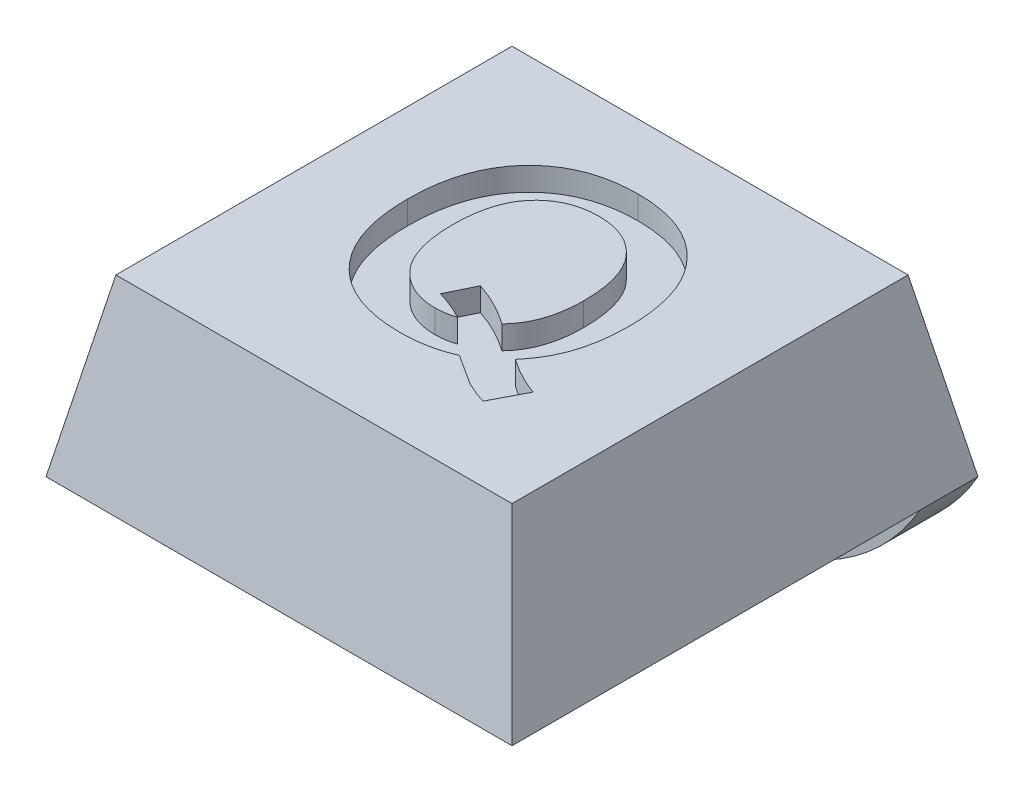
from build123d import *

# Parameters (mm, degrees)
SKETCH1_W               = 8
SKETCH1_H               = 8
BOSS_EXTRUDE1_DEPTH     = 3
CUT_EXTRUDE1_DEPTH      = 12.704699911
CUT_EXTRUDE1_DEPTH_BACK = 12.704699911
CUT_EXTRUDE2_DEPTH      = 11
SKETCH4_R               = 1.8
CUT_EXTRUDE3_DEPTH      = 0.8
SKETCH5_W               = 8
SKETCH5_H               = 1
BOSS_EXTRUDE2_DEPTH     = 2
FILLET1_R               = 4
CUT_EXTRUDE4_DEPTH      = 0.4


with BuildPart() as part:
    # Sketch1 → Boss-Extrude1 (new body)
    with BuildSketch(Plane(origin=(0, 0, 0), x_dir=(1, 0, 0), z_dir=(0, 1, 0))):
        with Locations((4, 4)):
            Rectangle(SKETCH1_W, SKETCH1_H)
    extrude(amount=BOSS_EXTRUDE1_DEPTH)

    # Sketch2 → Cut-Extrude1 (cut, two sides: drawn at the far end of the back side and taken through both)
    with BuildSketch(Plane.XY.offset(-CUT_EXTRUDE1_DEPTH_BACK)):
        Polygon((0, 0), (0.6, 3), (0, 3), align=None)
        Polygon((8, 0), (7.4, 3), (8, 3), align=None)
    extrude(amount=CUT_EXTRUDE1_DEPTH + CUT_EXTRUDE1_DEPTH_BACK, mode=Mode.SUBTRACT)

    # Sketch3 → Cut-Extrude2 (cut)
    with BuildSketch(Plane(origin=(0, 0, 0), x_dir=(0, 0, -1), z_dir=(1, 0, 0))):
        Polygon((0, 0), (0.6, 3), (0, 3), align=None)
        Polygon((8, 3), (7.4, 3), (8, 0), align=None)
    extrude(amount=CUT_EXTRUDE2_DEPTH, mode=Mode.SUBTRACT)

    # Sketch4 → Cut-Extrude3 (cut)
    with BuildSketch(Plane.XZ):
        with Locations(Location((4, -3.75, 0), (0, 0, 270))):
            Circle(SKETCH4_R)
    extrude(amount=-CUT_EXTRUDE3_DEPTH, mode=Mode.SUBTRACT)

    # Sketch5 → Boss-Extrude2 (add)
    with BuildSketch(Plane.XZ):
        with Locations((4, -7.5)):
            Rectangle(SKETCH5_W, SKETCH5_H)
    extrude(amount=BOSS_EXTRUDE2_DEPTH)

    # Fillet1
    # the kernel refuses this fillet: 4 mm, written as the material it takes off along each edge
    with BuildSketch(Plane(origin=(8, -2, -16.660254038), x_dir=(0, 1, 0), z_dir=(0, 0, 1)), Plane(origin=(0, -2, 1.660254038), x_dir=(0, 1, 0), z_dir=(0, 0, -1))) as fillet1_piece_1:
        with BuildLine():
            CenterArc((4, 3.464101615), FILLET1_R, 180, 60)
            Line((0, 3.464101615), (-0.08, 3.464101615))
            Line((-0.08, 3.464101615), (-0.08, 0))
            Line((-0.08, 0), (0, -0.08))
            ThreePointArc((0, -0.08), (1, -0.08), (1.96, -0.069282032))
            Line((1.96, -0.069282032), (2, 0))
        make_face()
    extrude(amount=18.320508076, mode=Mode.SUBTRACT)

    # Sketch6 → Cut-Extrude4 (cut)
    with BuildSketch(Plane(origin=(0, 3, 0), x_dir=(1, 0, 0), z_dir=(0, 1, 0))):
        with BuildLine():
            add(Edge.make_bspline(
                [(5.284087955, 2.773445367), (5.333545491, 2.739545524), (5.432652736, 2.671614118), (5.590291823, 2.583736248), (5.752942084, 2.503846486), (5.865979951, 2.460876102), (5.92270975, 2.439310751)],
                knots=[0, 0, 0, 0, 0.994855506, 1.99357661, 2.993045438, 4, 4, 4, 4], degree=3))
            Line((5.92270975, 2.439310751), (5.628639237, 1.875208187))
            add(Edge.make_bspline(
                [(5.628639237, 1.875208187), (5.568520037, 1.893818156), (5.447325875, 1.93133395), (5.332925255, 1.986187111), (5.275273852, 2.013829982)],
                knots=[0, 0, 0, 0, 0.992113803, 2, 2, 2, 2], degree=3))
            add(Edge.make_bspline(
                [(5.275273852, 2.013829982), (5.26961656, 2.016684314), (5.253233801, 2.024950075), (5.223476786, 2.045298413), (5.178074812, 2.072724498), (5.118973761, 2.11071311), (5.045578888, 2.157800121), (4.95765273, 2.213934729), (4.856407872, 2.280704114), (4.783596416, 2.327731001), (4.744825134, 2.35277229)],
                knots=[0, 0, 0, 0, 0.241377655, 0.698997227, 1.371388316, 2.263975901, 3.376788369, 4.695767198, 6.240533187, 8, 8, 8, 8], degree=3))
            add(Edge.make_bspline(
                [(4.744825134, 2.35277229), (4.712670389, 2.339001865), (4.648050063, 2.311327899), (4.547788838, 2.27725121), (4.444978029, 2.248544986), (4.339982896, 2.224200245), (4.232359046, 2.206111381), (4.122258624, 2.192239309), (4.00937299, 2.18410397), (3.933139287, 2.183304154), (3.894664878, 2.182900495)],
                knots=[0, 0, 0, 0, 0.961025642, 1.931341354, 2.907359807, 3.893838693, 4.891829695, 5.905170566, 6.942759923, 8, 8, 8, 8], degree=3))
            add(Edge.make_bspline(
                [(3.894664878, 2.182900495), (3.821683976, 2.184676763), (3.679027131, 2.188148859), (3.471015208, 2.212756542), (3.275562804, 2.255408477), (3.091812023, 2.313667662), (2.920867424, 2.390147666), (2.761229426, 2.482594503), (2.615108223, 2.593406711), (2.480490537, 2.71918809), (2.361392609, 2.861354588), (2.257130725, 3.017424584), (2.168806746, 3.186880722), (2.097587685, 3.370615377), (2.041301668, 3.567142879), (2.002926315, 3.777850586), (1.978227581, 4.001488849), (1.975427333, 4.155321196), (1.973991801, 4.234182546)],
                knots=[0, 0, 0, 0, 1.098101164, 2.146474535, 3.146072545, 4.104420533, 5.041773038, 5.958565538, 6.874115049, 7.795336865, 8.725215067, 9.658214839, 10.614563411, 11.594512188, 12.618591104, 13.685899083, 14.813688224, 16, 16, 16, 16], degree=3))
            add(Edge.make_bspline(
                [(1.973991801, 4.234182546), (1.97543059, 4.313040679), (1.978227497, 4.466335509), (2.002757559, 4.689542909), (2.042412611, 4.899497801), (2.098124704, 5.096337583), (2.170410456, 5.279545107), (2.259079723, 5.449017762), (2.363505524, 5.605417057), (2.484015277, 5.747270094), (2.617919267, 5.874338646), (2.764464989, 5.984327234), (2.9219486, 6.078236158), (3.090996271, 6.154643933), (3.272074664, 6.212871015), (3.463805003, 6.255387163), (3.667248709, 6.280295733), (3.806454886, 6.283712517), (3.877837955, 6.285464598)],
                knots=[0, 0, 0, 0, 1.193283781, 2.319662245, 3.393996131, 4.424093603, 5.411284417, 6.369670503, 7.313761776, 8.251713527, 9.181123148, 10.102053383, 11.01932051, 11.951118596, 12.903560284, 13.893239571, 14.919681386, 16, 16, 16, 16], degree=3))
            add(Edge.make_bspline(
                [(3.877837955, 6.285464598), (3.948708316, 6.284176334), (4.086935049, 6.281663683), (4.288489067, 6.254790298), (4.478939684, 6.214016744), (4.658513444, 6.155241629), (4.826290277, 6.078911265), (4.983143341, 5.98623667), (5.128157857, 5.876434989), (5.26137487, 5.750578969), (5.380523981, 5.609215368), (5.486073462, 5.454669187), (5.572731816, 5.285035211), (5.645736122, 5.103191508), (5.700157026, 4.90736457), (5.740330715, 4.69867705), (5.764520815, 4.476471411), (5.76739165, 4.323719862), (5.768863596, 4.245400495)],
                knots=[0, 0, 0, 0, 1.078752742, 2.104017338, 3.091035458, 4.041673215, 4.975566109, 5.892967701, 6.810684895, 7.740128604, 8.678185021, 9.621404646, 10.583875016, 11.573429805, 12.6009998, 13.674031063, 14.80742018, 16, 16, 16, 16], degree=3))
            add(Edge.make_bspline(
                [(5.768863596, 4.245400495), (5.767275795, 4.16278925), (5.764189157, 4.002195454), (5.737326284, 3.768977018), (5.693780668, 3.550562854), (5.648918616, 3.41330904), (5.627036673, 3.346362034)],
                knots=[0, 0, 0, 0, 1.083667057, 2.106616435, 3.076482036, 4, 4, 4, 4], degree=3))
            add(Edge.make_bspline(
                [(5.627036673, 3.346362034), (5.607421404, 3.297050064), (5.567517691, 3.196733787), (5.488642668, 3.051933408), (5.394797316, 2.909076479), (5.321514211, 2.819296637), (5.284087955, 2.773445367)],
                knots=[0, 0, 0, 0, 0.948216854, 1.928975575, 2.942311585, 4, 4, 4, 4], degree=3))
        make_face()
        with BuildLine():
            add(Edge.make_bspline(
                [(4.642261032, 3.185304341), (4.671182259, 3.216922768), (4.72909393, 3.280235293), (4.800707281, 3.388678336), (4.863230922, 3.50497094), (4.912388312, 3.632014464), (4.951923574, 3.76787431), (4.97951585, 3.913560578), (4.996652709, 4.068707035), (4.998621406, 4.175375245), (4.999632827, 4.230176136)],
                knots=[0, 0, 0, 0, 0.906820982, 1.815812261, 2.745108282, 3.70056618, 4.696560745, 5.740060838, 6.83895416, 8, 8, 8, 8], degree=3))
            add(Edge.make_bspline(
                [(4.999632827, 4.230176136), (4.998745764, 4.286560817), (4.997027382, 4.395786947), (4.982794262, 4.554398979), (4.957747484, 4.70183414), (4.925058455, 4.838707416), (4.88052022, 4.963910999), (4.826807351, 5.078388614), (4.763835344, 5.182421929), (4.690056733, 5.274294514), (4.608907177, 5.355063587), (4.522159409, 5.426414517), (4.428546166, 5.486139657), (4.328544236, 5.534184829), (4.222990468, 5.571989212), (4.111634776, 5.59943433), (3.994225982, 5.615495039), (3.913944994, 5.6176829), (3.873030263, 5.618797931)],
                knots=[0, 0, 0, 0, 1.335693338, 2.587451293, 3.768164612, 4.876224393, 5.916940853, 6.910477009, 7.867661778, 8.790666633, 9.694493319, 10.576027549, 11.446684429, 12.318352473, 13.199023277, 14.098364444, 15.030842682, 16, 16, 16, 16], degree=3))
            add(Edge.make_bspline(
                [(3.873030263, 5.618797931), (3.831841607, 5.617719084), (3.751279942, 5.615608947), (3.633755604, 5.599158788), (3.522145798, 5.573035665), (3.416723766, 5.534932642), (3.316536446, 5.486796326), (3.222573421, 5.427181815), (3.134847786, 5.356951252), (3.053289548, 5.276692152), (2.980446173, 5.184790487), (2.915694165, 5.082568667), (2.862164439, 4.968850144), (2.819178201, 4.84427298), (2.784825228, 4.709477379), (2.760087026, 4.563739976), (2.745835322, 4.407279692), (2.744110931, 4.299383286), (2.74322257, 4.243797931)],
                knots=[0, 0, 0, 0, 0.980107447, 1.917010591, 2.819119613, 3.703969481, 4.579773866, 5.459928929, 6.346604172, 7.250235365, 8.177620171, 9.131899985, 10.124404622, 11.161948974, 12.264485933, 13.431998172, 14.677033863, 16, 16, 16, 16], degree=3))
            add(Edge.make_bspline(
                [(2.74322257, 4.243797931), (2.744089067, 4.187408458), (2.745771696, 4.077907007), (2.760333697, 3.91913972), (2.783941374, 3.771215716), (2.817547327, 3.634196218), (2.86051391, 3.507924697), (2.913437174, 3.392577112), (2.976036542, 3.288297709), (3.048513511, 3.196032652), (3.128245057, 3.114861766), (3.213441608, 3.04409835), (3.303411645, 2.983479498), (3.39857486, 2.934226809), (3.498956775, 2.896402137), (3.604207339, 2.869103357), (3.714939061, 2.852831885), (3.790443662, 2.850669982), (3.82895975, 2.849567162)],
                knots=[0, 0, 0, 0, 1.356840463, 2.634818045, 3.833173645, 4.958776583, 6.025986406, 7.038359119, 8.007356852, 8.946032033, 9.855123386, 10.740685277, 11.607120956, 12.460971081, 13.313368256, 14.183325659, 15.073285775, 16, 16, 16, 16], degree=3))
            add(Edge.make_bspline(
                [(3.82895975, 2.849567162), (3.857844622, 2.850073951), (3.914741814, 2.851072222), (3.998801079, 2.862293633), (4.080683558, 2.878515583), (4.133570622, 2.895033243), (4.159889237, 2.903253059)],
                knots=[0, 0, 0, 0, 1.028828871, 2.026578908, 3.017950568, 4, 4, 4, 4], degree=3))
            add(Edge.make_bspline(
                [(4.159889237, 2.903253059), (4.119539232, 2.924336443), (4.039635796, 2.966086993), (3.916101198, 3.019284802), (3.792319766, 3.067214804), (3.708133251, 3.09310976), (3.666299493, 3.105977418)],
                knots=[0, 0, 0, 0, 1.021704821, 2.023239566, 3.017713044, 4, 4, 4, 4], degree=3))
            Line((3.666299493, 3.105977418), (3.889857186, 3.56751588))
            add(Edge.make_bspline(
                [(3.889857186, 3.56751588), (3.955233958, 3.544923565), (4.086618506, 3.49952088), (4.276409331, 3.409366748), (4.463555304, 3.306758821), (4.582244486, 3.226093623), (4.642261032, 3.185304341)],
                knots=[0, 0, 0, 0, 0.979271047, 1.967993817, 2.972492781, 4, 4, 4, 4], degree=3))
        make_face(mode=Mode.SUBTRACT)
    extrude(amount=-CUT_EXTRUDE4_DEPTH, mode=Mode.SUBTRACT)


solid = part.part
